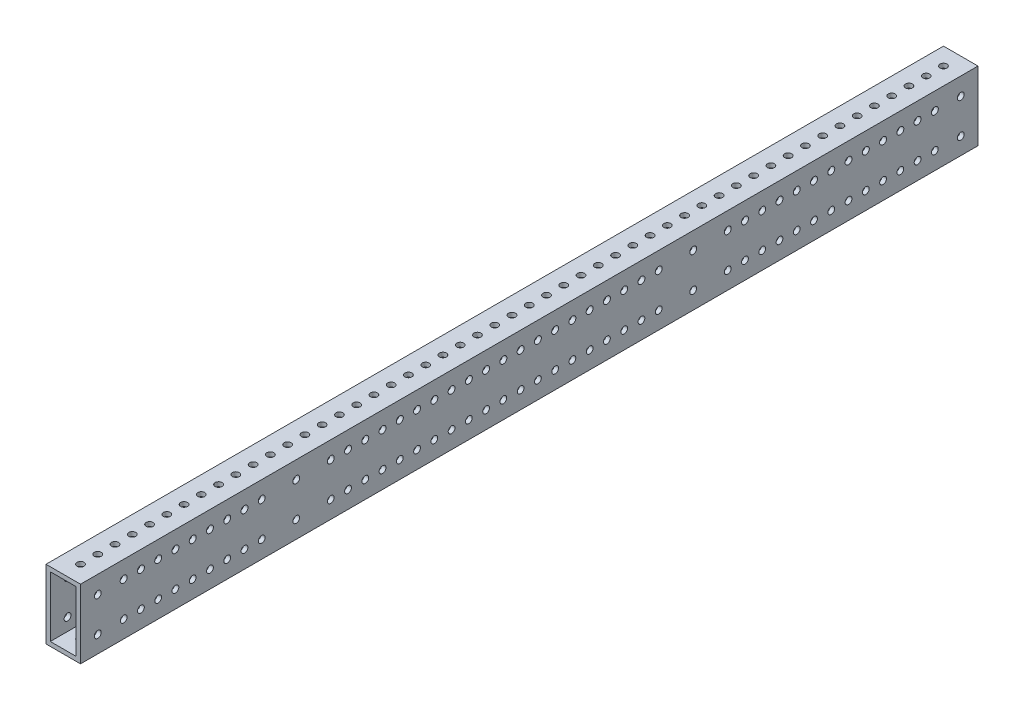
from build123d import *

# Parameters (mm, degrees)
SKETCH1_W           = 25.4
SKETCH1_H           = 50.8
SKETCH1_W_2         = 19.05
SKETCH1_H_2         = 44.45
BOSS_EXTRUDE1_DEPTH = 330.2
SKETCH2_R           = 2.5527
CUT_EXTRUDE1_DEPTH  = 335.32614316
SKETCH4_R           = 2.4892
SKETCH4_R_2         = 2.5527
CUT_EXTRUDE3_DEPTH  = 333.148099498


with BuildPart() as part:
    # Sketch1 → Boss-Extrude1 (new, symmetric)
    with BuildSketch(Plane.XY):
        Rectangle(SKETCH1_W, SKETCH1_H)
        Rectangle(SKETCH1_W_2, SKETCH1_H_2, mode=Mode.SUBTRACT)
    extrude(amount=BOSS_EXTRUDE1_DEPTH, both=True)

    # Sketch2 → Cut-Extrude1 (cut, through all)
    with BuildSketch(Plane(origin=(0, 25.4, 0), x_dir=(1, 0, 0), z_dir=(0, 1, 0))):
        with Locations((0, -317.5)):
            Circle(SKETCH2_R)
        with Locations((0, -304.8)):
            Circle(SKETCH2_R)
        with Locations((0, -292.1)):
            Circle(SKETCH2_R)
        with Locations((0, -279.4)):
            Circle(SKETCH2_R)
        with Locations((0, -266.7)):
            Circle(SKETCH2_R)
        with Locations((0, -254)):
            Circle(SKETCH2_R)
        with Locations((0, -241.3)):
            Circle(SKETCH2_R)
        with Locations((0, -228.6)):
            Circle(SKETCH2_R)
        with Locations((0, -215.9)):
            Circle(SKETCH2_R)
        with Locations((0, -203.2)):
            Circle(SKETCH2_R)
        with Locations((0, -190.5)):
            Circle(SKETCH2_R)
        with Locations((0, -177.8)):
            Circle(SKETCH2_R)
        with Locations((0, -165.1)):
            Circle(SKETCH2_R)
        with Locations((0, -152.4)):
            Circle(SKETCH2_R)
        with Locations((0, -139.7)):
            Circle(SKETCH2_R)
        with Locations((0, -127)):
            Circle(SKETCH2_R)
        with Locations((0, -114.3)):
            Circle(SKETCH2_R)
        with Locations((0, -101.6)):
            Circle(SKETCH2_R)
        with Locations((0, -88.9)):
            Circle(SKETCH2_R)
        with Locations((0, -76.2)):
            Circle(SKETCH2_R)
        with Locations((0, -63.5)):
            Circle(SKETCH2_R)
        with Locations((0, -50.8)):
            Circle(SKETCH2_R)
        with Locations((0, -38.1)):
            Circle(SKETCH2_R)
        with Locations((0, -25.4)):
            Circle(SKETCH2_R)
        with Locations((0, -12.7)):
            Circle(SKETCH2_R)
        Circle(SKETCH2_R)
        with Locations((0, 12.7)):
            Circle(SKETCH2_R)
        with Locations((0, 25.4)):
            Circle(SKETCH2_R)
        with Locations((0, 38.1)):
            Circle(SKETCH2_R)
        with Locations((0, 50.8)):
            Circle(SKETCH2_R)
        with Locations((0, 63.5)):
            Circle(SKETCH2_R)
        with Locations((0, 76.2)):
            Circle(SKETCH2_R)
        with Locations((0, 88.9)):
            Circle(SKETCH2_R)
        with Locations((0, 101.6)):
            Circle(SKETCH2_R)
        with Locations((0, 114.3)):
            Circle(SKETCH2_R)
        with Locations((0, 127)):
            Circle(SKETCH2_R)
        with Locations((0, 139.7)):
            Circle(SKETCH2_R)
        with Locations((0, 152.4)):
            Circle(SKETCH2_R)
        with Locations((0, 165.1)):
            Circle(SKETCH2_R)
        with Locations((0, 177.8)):
            Circle(SKETCH2_R)
        with Locations((0, 190.5)):
            Circle(SKETCH2_R)
        with Locations((0, 203.2)):
            Circle(SKETCH2_R)
        with Locations((0, 215.9)):
            Circle(SKETCH2_R)
        with Locations((0, 228.6)):
            Circle(SKETCH2_R)
        with Locations((0, 241.3)):
            Circle(SKETCH2_R)
        with Locations((0, 254)):
            Circle(SKETCH2_R)
        with Locations((0, 266.7)):
            Circle(SKETCH2_R)
        with Locations((0, 279.4)):
            Circle(SKETCH2_R)
        with Locations((0, 292.1)):
            Circle(SKETCH2_R)
        with Locations((0, 304.8)):
            Circle(SKETCH2_R)
        with Locations((0, 317.5)):
            Circle(SKETCH2_R)
    extrude(amount=-CUT_EXTRUDE1_DEPTH, mode=Mode.SUBTRACT)

    # Sketch4 → Cut-Extrude3 (cut, through all)
    with BuildSketch(Plane(origin=(12.7, 0, 0), x_dir=(0, 0, -1), z_dir=(1, 0, 0))):
        with Locations((-298.45, -12.7)):
            Circle(SKETCH4_R)
        with Locations((-285.75, -12.7)):
            Circle(SKETCH4_R)
        with Locations((-273.05, -12.7)):
            Circle(SKETCH4_R)
        with Locations((120.65, -12.7)):
            Circle(SKETCH4_R)
        with Locations((146.05, -12.7)):
            Circle(SKETCH4_R)
        with Locations((158.75, -12.7)):
            Circle(SKETCH4_R)
        with Locations((171.45, -12.7)):
            Circle(SKETCH4_R)
        with Locations((184.15, -12.7)):
            Circle(SKETCH4_R)
        with Locations((196.85, -12.7)):
            Circle(SKETCH4_R)
        with Locations((209.55, -12.7)):
            Circle(SKETCH4_R)
        with Locations((222.25, -12.7)):
            Circle(SKETCH4_R)
        with Locations((234.95, -12.7)):
            Circle(SKETCH4_R)
        with Locations((247.65, -12.7)):
            Circle(SKETCH4_R)
        with Locations((260.35, -12.7)):
            Circle(SKETCH4_R)
        with Locations((273.05, -12.7)):
            Circle(SKETCH4_R)
        with Locations((-260.35, -12.7)):
            Circle(SKETCH4_R)
        with Locations((-247.65, -12.7)):
            Circle(SKETCH4_R)
        with Locations((-234.95, -12.7)):
            Circle(SKETCH4_R)
        with Locations((-222.25, -12.7)):
            Circle(SKETCH4_R)
        with Locations((-209.55, -12.7)):
            Circle(SKETCH4_R)
        with Locations((-196.85, -12.7)):
            Circle(SKETCH4_R)
        with Locations((-171.45, -12.7)):
            Circle(SKETCH4_R)
        with Locations((-146.05, -12.7)):
            Circle(SKETCH4_R)
        with Locations((-133.35, -12.7)):
            Circle(SKETCH4_R)
        with Locations((-120.65, -12.7)):
            Circle(SKETCH4_R)
        with Locations((-107.95, -12.7)):
            Circle(SKETCH4_R)
        with Locations((-95.25, -12.7)):
            Circle(SKETCH4_R)
        with Locations((-82.55, -12.7)):
            Circle(SKETCH4_R)
        with Locations((-69.85, -12.7)):
            Circle(SKETCH4_R)
        with Locations((-57.15, -12.7)):
            Circle(SKETCH4_R)
        with Locations((-44.45, -12.7)):
            Circle(SKETCH4_R)
        with Locations((-31.75, -12.7)):
            Circle(SKETCH4_R)
        with Locations((-19.05, -12.7)):
            Circle(SKETCH4_R)
        with Locations((-6.35, -12.7)):
            Circle(SKETCH4_R)
        with Locations((6.35, -12.7)):
            Circle(SKETCH4_R)
        with Locations((19.05, -12.7)):
            Circle(SKETCH4_R)
        with Locations((31.75, -12.7)):
            Circle(SKETCH4_R)
        with Locations((44.45, -12.7)):
            Circle(SKETCH4_R)
        with Locations((57.15, -12.7)):
            Circle(SKETCH4_R)
        with Locations((69.85, -12.7)):
            Circle(SKETCH4_R)
        with Locations((82.55, -12.7)):
            Circle(SKETCH4_R)
        with Locations((95.25, -12.7)):
            Circle(SKETCH4_R)
        with Locations((-298.45, 12.7)):
            Circle(SKETCH4_R_2)
        with Locations((-285.75, 12.7)):
            Circle(SKETCH4_R_2)
        with Locations((-273.05, 12.7)):
            Circle(SKETCH4_R_2)
        with Locations((-260.35, 12.7)):
            Circle(SKETCH4_R_2)
        with Locations((-247.65, 12.7)):
            Circle(SKETCH4_R_2)
        with Locations((-234.95, 12.7)):
            Circle(SKETCH4_R_2)
        with Locations((-222.25, 12.7)):
            Circle(SKETCH4_R_2)
        with Locations((-209.55, 12.7)):
            Circle(SKETCH4_R_2)
        with Locations((-196.85, 12.7)):
            Circle(SKETCH4_R_2)
        with Locations((-171.45, 12.7)):
            Circle(SKETCH4_R_2)
        with Locations((-146.05, 12.7)):
            Circle(SKETCH4_R_2)
        with Locations((-133.35, 12.7)):
            Circle(SKETCH4_R_2)
        with Locations((-120.65, 12.7)):
            Circle(SKETCH4_R_2)
        with Locations((-107.95, 12.7)):
            Circle(SKETCH4_R_2)
        with Locations((-95.25, 12.7)):
            Circle(SKETCH4_R_2)
        with Locations((-82.55, 12.7)):
            Circle(SKETCH4_R_2)
        with Locations((-69.85, 12.7)):
            Circle(SKETCH4_R_2)
        with Locations((-57.15, 12.7)):
            Circle(SKETCH4_R_2)
        with Locations((-44.45, 12.7)):
            Circle(SKETCH4_R_2)
        with Locations((-31.75, 12.7)):
            Circle(SKETCH4_R_2)
        with Locations((-19.05, 12.7)):
            Circle(SKETCH4_R_2)
        with Locations((-6.35, 12.7)):
            Circle(SKETCH4_R_2)
        with Locations((6.35, 12.7)):
            Circle(SKETCH4_R_2)
        with Locations((19.05, 12.7)):
            Circle(SKETCH4_R_2)
        with Locations((31.75, 12.7)):
            Circle(SKETCH4_R_2)
        with Locations((44.45, 12.7)):
            Circle(SKETCH4_R_2)
        with Locations((57.15, 12.7)):
            Circle(SKETCH4_R_2)
        with Locations((69.85, 12.7)):
            Circle(SKETCH4_R_2)
        with Locations((82.55, 12.7)):
            Circle(SKETCH4_R_2)
        with Locations((95.25, 12.7)):
            Circle(SKETCH4_R_2)
        with Locations((120.65, 12.7)):
            Circle(SKETCH4_R_2)
        with Locations((146.05, 12.7)):
            Circle(SKETCH4_R_2)
        with Locations((158.75, 12.7)):
            Circle(SKETCH4_R_2)
        with Locations((171.45, 12.7)):
            Circle(SKETCH4_R_2)
        with Locations((184.15, 12.7)):
            Circle(SKETCH4_R_2)
        with Locations((196.85, 12.7)):
            Circle(SKETCH4_R_2)
        with Locations((209.55, 12.7)):
            Circle(SKETCH4_R_2)
        with Locations((222.25, 12.7)):
            Circle(SKETCH4_R_2)
        with Locations((234.95, 12.7)):
            Circle(SKETCH4_R_2)
        with Locations((247.65, 12.7)):
            Circle(SKETCH4_R_2)
        with Locations((260.35, 12.7)):
            Circle(SKETCH4_R_2)
        with Locations((273.05, 12.7)):
            Circle(SKETCH4_R_2)
        with Locations((285.75, 12.7)):
            Circle(SKETCH4_R_2)
        with Locations((285.75, -12.7)):
            Circle(SKETCH4_R)
        with Locations((298.45, 12.7)):
            Circle(SKETCH4_R_2)
        with Locations((298.45, -12.7)):
            Circle(SKETCH4_R)
        with Locations((-317.5, 12.446)):
            Circle(SKETCH4_R_2)
        with Locations((-317.5, -12.954)):
            Circle(SKETCH4_R_2)
        with Locations((317.5, 12.446)):
            Circle(SKETCH4_R_2)
        with Locations((317.5, -12.954)):
            Circle(SKETCH4_R_2)
    extrude(amount=-CUT_EXTRUDE3_DEPTH, mode=Mode.SUBTRACT)


solid = part.part
